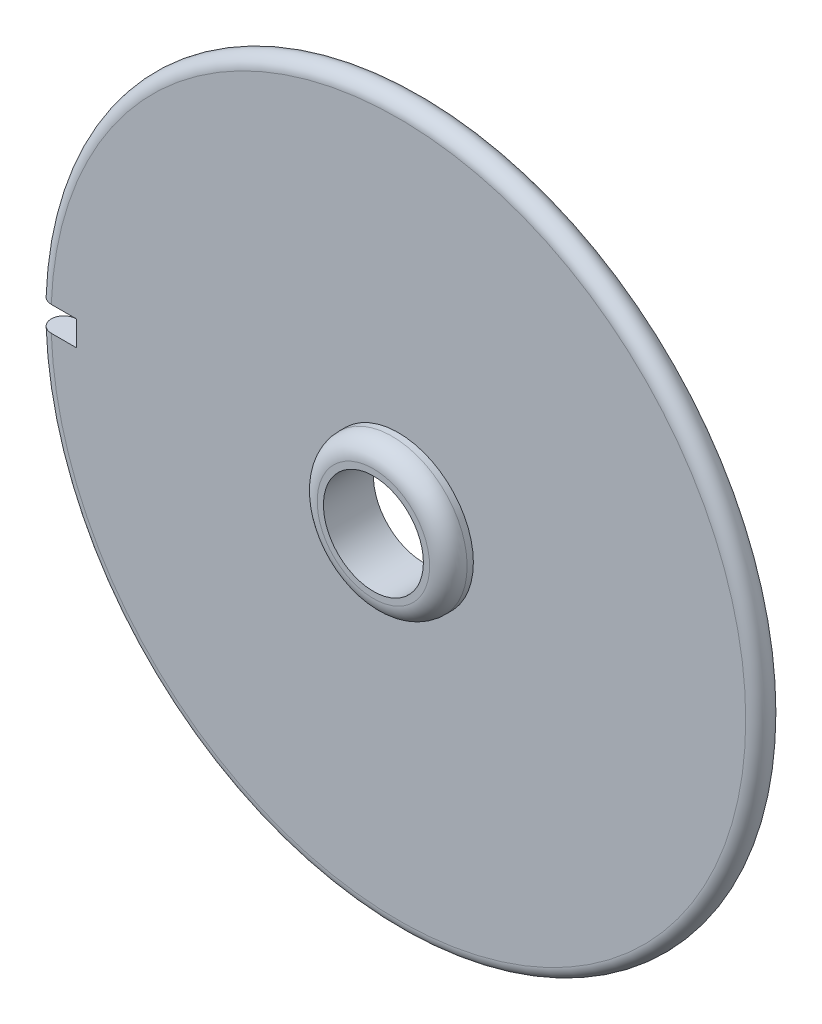
from build123d import *

# Parameters (mm, degrees)
SKETCH1_R           = 6
BOSS_EXTRUDE1_DEPTH = 2
SKETCH2_R           = 28.8
BOSS_EXTRUDE2_DEPTH = 2
SKETCH3_R           = 4
CUT_EXTRUDE1_DEPTH  = 141.3450391
FILLET1_R           = 1.5
FILLET2_R           = 1
SKETCH4_W           = 6
SKETCH4_H           = 2
CUT_EXTRUDE2_DEPTH  = 141.345039121


with BuildPart() as part:
    # Sketch1 → Boss-Extrude1 (new body)
    with BuildSketch(Plane.XY):
        with Locations((0, -108.5)):
            Circle(SKETCH1_R)
    extrude(amount=-BOSS_EXTRUDE1_DEPTH)

    # Sketch2 → Boss-Extrude2 (add)
    with BuildSketch(Plane(origin=(0, 0, -2), x_dir=(-1, 0, 0), z_dir=(0, 0, -1))):
        with Locations((0, -108.5)):
            Circle(SKETCH2_R)
    extrude(amount=BOSS_EXTRUDE2_DEPTH)

    # Sketch3 → Cut-Extrude1 (cut, through all)
    with BuildSketch(Plane.XY):
        with Locations((0, -108.5)):
            Circle(SKETCH3_R)
    extrude(amount=-CUT_EXTRUDE1_DEPTH, mode=Mode.SUBTRACT)

    # Fillet1
    fillet1_edges = [part.edges().sort_by_distance(p)[0] for p in [
        (-6, -108.5, 0),
    ]]
    fillet(fillet1_edges, radius=FILLET1_R)

    # Fillet2
    fillet2_edges = [part.edges().sort_by_distance(p)[0] for p in [
        (28.8, -108.5, -2),
        (28.8, -108.5, -4),
    ]]
    fillet(fillet2_edges, radius=FILLET2_R - 0.0001)  # a hair under: the kernel refuses the full size

    # Sketch4 → Cut-Extrude2 (cut, through all)
    with BuildSketch(Plane.XY):
        with Locations((-28.782633653, -108.5)):
            Rectangle(SKETCH4_W, SKETCH4_H)
    extrude(amount=-CUT_EXTRUDE2_DEPTH, mode=Mode.SUBTRACT)


solid = part.part
